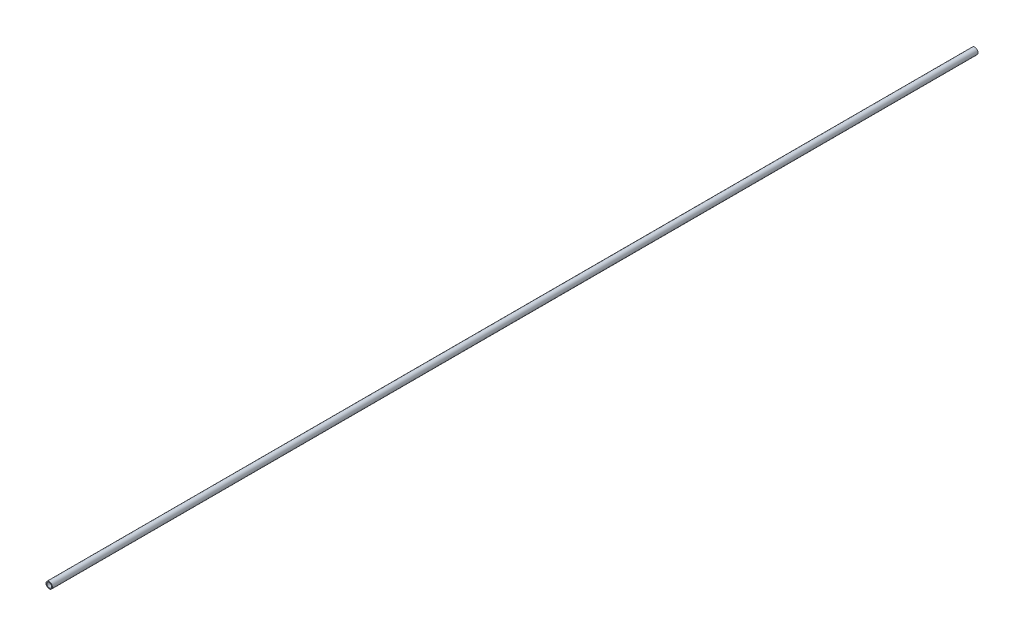
from build123d import *

# Parameters (mm, degrees)
SKETCH1_R           = 6.35
SKETCH1_R_2         = 4.7625
BOSS_EXTRUDE1_DEPTH = 1828.8


with BuildPart() as part:
    # Sketch1 → Boss-Extrude1 (new body)
    with BuildSketch(Plane.XY):
        Circle(SKETCH1_R)
        Circle(SKETCH1_R_2, mode=Mode.SUBTRACT)
    extrude(amount=BOSS_EXTRUDE1_DEPTH)


solid = part.part
